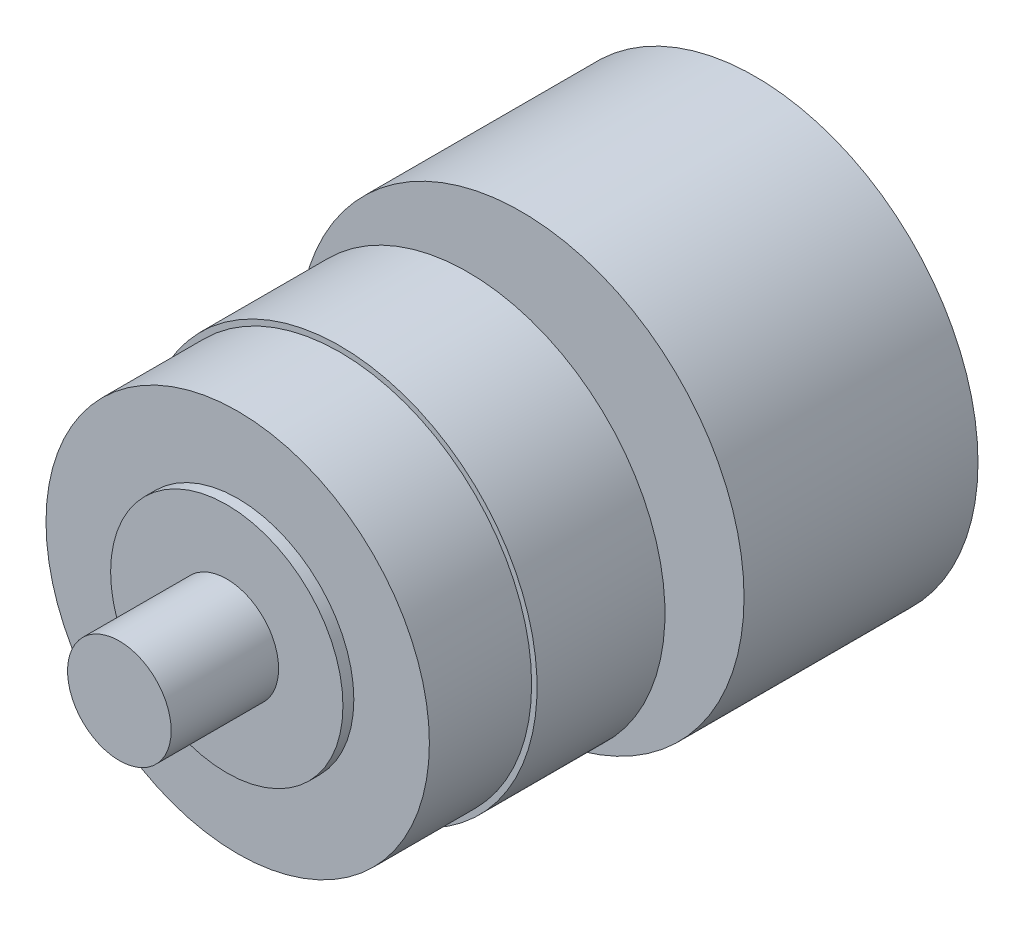
from build123d import *

# Parameters (mm, degrees)
SKETCH1_R          = 2.413
EXTRUDE1_DEPTH     = 5.0038
SKETCH2_R          = 5.4102
EXTRUDE2_DEPTH     = 0.508
SKETCH3_R          = 8.9281
EXTRUDE3_DEPTH     = 4.7625
SKETCH4_R          = 9.1821
EXTRUDE4_DEPTH     = 5.9563
SKETCH6_R          = 6.35
EXTRUDE5_DEPTH     = 2.2352
EXTRUDE5_TAPER     = 45
SKETCH7_R          = 4.1148
EXTRUDE6_DEPTH     = 0.254
SKETCH8_R          = 10.3759
EXTRUDE7_DEPTH     = 10.8966
SKETCH9_R          = 5.08
EXTRUDE8_DEPTH     = 0.127
EXTRUDE9_DEPTH     = 1.524
SKETCH11_OUTSIDE_W = 34.376
SKETCH11_OUTSIDE_H = 34.376
SKETCH11_OUTSIDE_R = 6.3373
CUT_EXTRUDE1_DEPTH = 1.524
CUT_EXTRUDE1_DRAFT = -45


with BuildPart() as part:
    # Sketch1 → Extrude1 (new body)
    with BuildSketch(Plane.XY):
        Circle(SKETCH1_R)
    extrude(amount=-EXTRUDE1_DEPTH)

    # Sketch2 → Extrude2 (add)
    with BuildSketch(Plane(origin=(0, 0, -5.0038), x_dir=(-1, 0, 0), z_dir=(0, 0, -1))):
        Circle(SKETCH2_R)
    extrude(amount=EXTRUDE2_DEPTH)

    # Sketch3 → Extrude3 (add)
    with BuildSketch(Plane(origin=(0, 0, -5.5118), x_dir=(-1, 0, 0), z_dir=(0, 0, -1))):
        Circle(SKETCH3_R)
    extrude(amount=EXTRUDE3_DEPTH)

    # Sketch4 → Extrude4 (add)
    with BuildSketch(Plane(origin=(0, 0, -10.2743), x_dir=(-1, 0, 0), z_dir=(0, 0, -1))):
        Circle(SKETCH4_R)
    extrude(amount=EXTRUDE4_DEPTH)

    # Sketch6 → Extrude5 (add)
    with BuildSketch(Plane(origin=(0, 0, -16.2306), x_dir=(-1, 0, 0), z_dir=(0, 0, -1))):
        Circle(SKETCH6_R)
    extrude(amount=EXTRUDE5_DEPTH, taper=EXTRUDE5_TAPER)

    # Sketch7 → Extrude6 (add)
    with BuildSketch(Plane(origin=(0, 0, -18.4658), x_dir=(-1, 0, 0), z_dir=(0, 0, -1))):
        Circle(SKETCH7_R)
    extrude(amount=EXTRUDE6_DEPTH)

    # Sketch8 → Extrude7 (add)
    with BuildSketch(Plane(origin=(0, 0, -18.7198), x_dir=(-1, 0, 0), z_dir=(0, 0, -1))):
        Circle(SKETCH8_R)
    extrude(amount=EXTRUDE7_DEPTH)

    # Sketch9 → Extrude8 (add)
    with BuildSketch(Plane(origin=(0, 0, -29.6164), x_dir=(-1, 0, 0), z_dir=(0, 0, -1))):
        Circle(SKETCH9_R)
    extrude(amount=EXTRUDE8_DEPTH)

    # Sketch10 → Extrude9 (add)
    with BuildSketch(Plane(origin=(0, 0, -29.7434), x_dir=(-1, 0, 0), z_dir=(0, 0, -1))):
        Polygon((7.332348419, 0), (3.666174209, 6.35), (-3.666174209, 6.35), (-7.332348419, 0), (-3.666174209, -6.35), (3.666174209, -6.35), align=None)
    extrude(amount=EXTRUDE9_DEPTH)


with BuildPart() as cut_extrude1_tool:
    # Sketch11 outside → Cut-Extrude1 (with draft: the straight prism first)
    with BuildSketch(Plane(origin=(0, 0, -31.2674), x_dir=(-1, 0, 0), z_dir=(0, 0, -1))):
        Rectangle(SKETCH11_OUTSIDE_W, SKETCH11_OUTSIDE_H)
        Circle(SKETCH11_OUTSIDE_R, mode=Mode.SUBTRACT)
    extrude(amount=-CUT_EXTRUDE1_DEPTH)
    # Cut-Extrude1: the draft: its side faces are tilted about the plane it starts from
    cut_extrude1_sides = [cut_extrude1_tool.faces().sort_by_distance(p)[0] for p in [
        (0, -17.188, -30.5054),
        (-17.188, 0, -30.5054),
        (0, 17.188, -30.5054),
        (17.188, 0, -30.5054),
        (6.3373, 0, -30.5054),
    ]]
    draft(cut_extrude1_sides, Plane(origin=(0, 0, -31.2674), x_dir=(-1, 0, 0), z_dir=(0, 0, -1)), CUT_EXTRUDE1_DRAFT)


with BuildPart() as part_1:
    add(part.part)

    # Cut-Extrude1: cut by cut_extrude1_tool
    add(cut_extrude1_tool.part, mode=Mode.SUBTRACT)


solid = part_1.part
